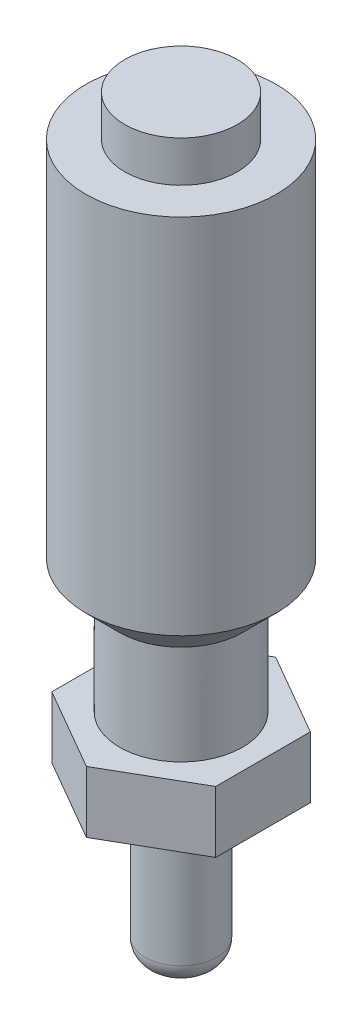
from build123d import *

# Parameters (mm, degrees)
SKETCH_1_R          = 1.75
EXTRUDE_1_DEPTH     = 7.5
SKETCH_2_R          = 3
EXTRUDE_2_DEPTH     = 7.5
SKETCH_3_R          = 4.65
EXTRUDE_3_DEPTH     = 21.7
FILLET_1_R          = 1
EXTRUDE_4_DEPTH     = 3
CUT_EXTRUDE_START   = -2
SKETCH_5_R          = 4.65
SKETCH_5_R_2        = 2.75
CUT_EXTRUDE_1_DEPTH = 2
CHAMFER_1_SIZE      = 2


with BuildPart() as part:
    # 草图1 → 凸台-拉伸1 (new body)
    with BuildSketch(Plane(origin=(0, 0, 0), x_dir=(1, 0, 0), z_dir=(0, 1, 0))):
        with Locations(Location((0, 0, 0), (0, 0, 270))):
            Circle(SKETCH_1_R)
    extrude(amount=EXTRUDE_1_DEPTH)

    # 草图2 → 凸台-拉伸2 (add)
    with BuildSketch(Plane(origin=(0, 7.5, 0), x_dir=(1, 0, 0), z_dir=(0, 1, 0))):
        with Locations(Location((0, 0, 0), (0, 0, 270))):
            Circle(SKETCH_2_R)
    extrude(amount=EXTRUDE_2_DEPTH)

    # 草图3 → 凸台-拉伸3 (add)
    with BuildSketch(Plane(origin=(0, 15, 0), x_dir=(1, 0, 0), z_dir=(0, 1, 0))):
        with Locations(Location((0, 0, 0), (0, 0, 270))):
            Circle(SKETCH_3_R)
    extrude(amount=EXTRUDE_3_DEPTH)

    # 圆角1
    fillet_1_edges = [part.edges().sort_by_distance(p)[0] for p in [
        (0, 0, -1.75),
    ]]
    fillet(fillet_1_edges, radius=FILLET_1_R)

    # 草图4 → 凸台-拉伸4 (add)
    with BuildSketch(Plane.XZ.offset(-7.5)):
        Polygon((0, 4.618802154), (-4, 2.309401077), (-4, -2.309401077), (0, -4.618802154), (4, -2.309401077), (4, 2.309401077), align=None)
    extrude(amount=-EXTRUDE_4_DEPTH)

    # 草图5 → 切除-拉伸1 (cut)
    with BuildSketch(Plane(origin=(0, 36.7, 0), x_dir=(1, 0, 0), z_dir=(0, 1, 0)).offset(CUT_EXTRUDE_START)):
        with Locations(Location((0, 0, 0), (0, 0, 270))):
            Circle(SKETCH_5_R)
        with Locations(Location((0, 0, 0), (0, 0, 270))):
            Circle(SKETCH_5_R_2, mode=Mode.SUBTRACT)
    extrude(amount=CUT_EXTRUDE_1_DEPTH, mode=Mode.SUBTRACT)

    # 倒角1
    # the kernel refuses this chamfer: 2 mm, written as the material it takes off along each edge
    with BuildSketch(Plane(origin=(0, 15, 0), x_dir=(0, 0, 1), z_dir=(-1, 0, 0))) as chamfer_1_piece_1_section:
        Polygon((4.65 - CHAMFER_1_SIZE, 0), (4.65, CHAMFER_1_SIZE), (4.65, 0), align=None)
    chamfer_1_piece_1 = revolve(axis=Axis((0, 15, 0), (0, 1, 0)), mode=Mode.PRIVATE)
    chamfer_1_piece_1 = chamfer_1_piece_1 - Plane(origin=(0, 16.176636647, 0), x_dir=(0, 0, 1), z_dir=(0, -1, 0)) * Cylinder(3, 19, mode=Mode.PRIVATE)
    add(chamfer_1_piece_1, mode=Mode.SUBTRACT)


solid = part.part
